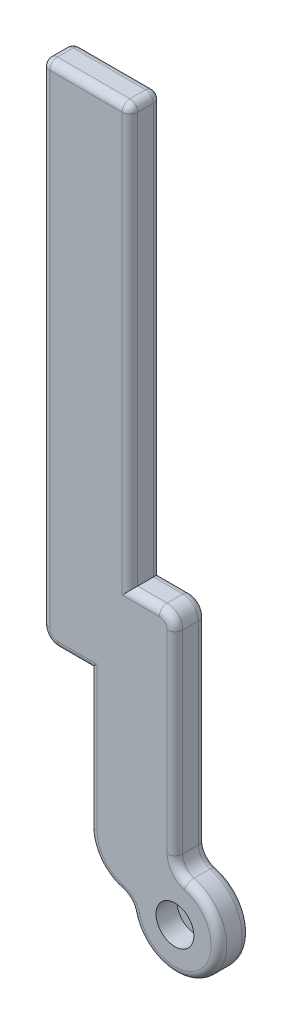
from build123d import *

# Parameters (mm, degrees)
BOSS_EXTRU_1_DEPTH      = 4
ESQUISSE4_R             = 2.43
ENL_V_MAT_EXTRU_1_DEPTH = 2.7
ESQUISSE5_R             = 0.75
ENL_V_MAT_EXTRU_2_DEPTH = 1.3
CONG_1_R                = 1
ESQUISSE6_W             = 5.35
ESQUISSE6_H             = 23
BOSS_EXTRU_2_DEPTH      = 4
CONG_4_R                = 5.45
ENL_V_START             = -4
ENL_V_MAT_EXTRU_3_DEPTH = 4
CONG_5_R                = 2
CONG_6_R                = 2
CONG_7_R                = 1


with BuildPart() as part:
    # Esquisse3 → Boss.-Extru.1 (new body)
    with BuildSketch(Plane.XY):
        with BuildLine():
            Line((0, 0), (0, 65))
            Line((0, 65), (11.3, 65))
            Line((11.3, 65), (11.3, 11.3))
            Line((11.3, 11.3), (22.73, 11.3))
            Line((22.73, 11.3), (22.73, -23))
            ThreePointArc((22.73, -23), (17.08, -28.65), (11.43, -23))
            Line((11.43, -23), (11.43, 0))
            Line((11.43, 0), (0, 0))
        make_face()
    extrude(amount=BOSS_EXTRU_1_DEPTH)

    # Esquisse4 → Enlèv. mat.-Extru.1 (cut)
    with BuildSketch(Plane.XY.offset(4)):
        with Locations((17.08, -23)):
            Circle(ESQUISSE4_R)
    extrude(amount=-ENL_V_MAT_EXTRU_1_DEPTH, mode=Mode.SUBTRACT)

    # Esquisse5 → Enlèv. mat.-Extru.2 (cut)
    with BuildSketch(Plane.XY.offset(1.3)):
        with Locations((17.08, -23)):
            Circle(ESQUISSE5_R)
    extrude(amount=-ENL_V_MAT_EXTRU_2_DEPTH, mode=Mode.SUBTRACT)

    # Congé1
    cong_1_edges = [part.edges().sort_by_distance(p)[0] for p in [
        (0, 65, 2),
        (11.3, 65, 2),
    ]]
    fillet(cong_1_edges, radius=CONG_1_R)

    # Esquisse6 → Boss.-Extru.2 (add)
    with BuildSketch(Plane.XY.offset(4)):
        with Locations((8.755, -11.5)):
            Rectangle(ESQUISSE6_W, ESQUISSE6_H)
    extrude(amount=-BOSS_EXTRU_2_DEPTH)

    # Congé4
    # the kernel refuses this fillet: 5.45 mm, written as the material it takes off along each edge
    with BuildSketch(Plane(origin=(6.08, -23, 17.625), x_dir=(0, 1, 0), z_dir=(0, 0, -1))) as cong_4_piece_1_section:
        with BuildLine():
            CenterArc((CONG_4_R, CONG_4_R), CONG_4_R, 180, 90)
            Line((0, CONG_4_R), (0, 0))
            Line((0, 0), (CONG_4_R, 0))
        make_face()
    cong_4_piece_1 = extrude(amount=31.25, mode=Mode.PRIVATE)
    cong_4_piece_1 = cong_4_piece_1 - Plane(origin=(17.08, -23, 2), x_dir=(1, 0, 0), z_dir=(0, 0, -1)) * Cylinder(5.65, 85, mode=Mode.PRIVATE)
    add(cong_4_piece_1, mode=Mode.SUBTRACT)

    # Esquisse7 → Enlèv. mat.-Extru.3 (cut)
    with BuildSketch(Plane.XY.offset(4).offset(ENL_V_START)):
        with BuildLine():
            Line((17.08, -17.35), (17.08, 11.3))
            Line((17.08, 11.3), (22.73, 11.3))
            Line((22.73, 11.3), (22.73, -23))
            ThreePointArc((22.73, -23), (21.075153314, -19.004846686), (17.08, -17.35))
        make_face()
    extrude(amount=ENL_V_MAT_EXTRU_3_DEPTH, mode=Mode.SUBTRACT)

    # Congé5
    cong_5_edges = [part.edges().sort_by_distance(p)[0] for p in [
        (0, 0, 2),
        (17.08, 11.3, 2),
    ]]
    fillet(cong_5_edges, radius=CONG_5_R)

    # Congé6
    cong_6_edges = [part.edges().sort_by_distance(p)[0] for p in [
        (11.430000074, -22.999082493, 2),
        (17.08, -17.35, 2),
    ]]
    fillet(cong_6_edges, radius=CONG_6_R)

    # Congé7
    cong_7_edges = [part.edges().sort_by_distance(p)[0] for p in [
        (11.3, 37.65, 4),
        (0, 33, 0),
        (0, 33, 4),
        (5.65, 65, 0),
        (11.007106781, 64.707106781, 0),
        (0.292893219, 64.707106781, 0),
        (5.65, 65, 4),
        (11.007106781, 64.707106781, 4),
        (0.292893219, 64.707106781, 4),
        (6.08, -8.775, 0),
        (6.08, -8.775, 4),
        (7.213643754, -20.877396694, 4),
        (17.08, -3.158032367, 4),
        (17.08, -3.158032367, 0),
        (13.19, 11.3, 4),
        (4.04, 0, 4),
        (0.585786438, 0.585786438, 4),
        (16.494213562, 10.714213562, 4),
        (13.19, 11.3, 0),
        (4.04, 0, 0),
        (0.585786438, 0.585786438, 0),
        (16.494213562, 10.714213562, 0),
        (21.008529301, -27.060684367, 0),
        (11.3, 37.65, 0),
        (21.008529301, -27.060684367, 4),
        (7.213643754, -20.877396694, 0),
        (11.066365829, -23.35890716, 0),
        (11.066365829, -23.35890716, 4),
        (17.491643674, -16.831434713, 4),
        (17.491643674, -16.831434713, 0),
    ]]
    fillet(cong_7_edges, radius=CONG_7_R)


solid = part.part
